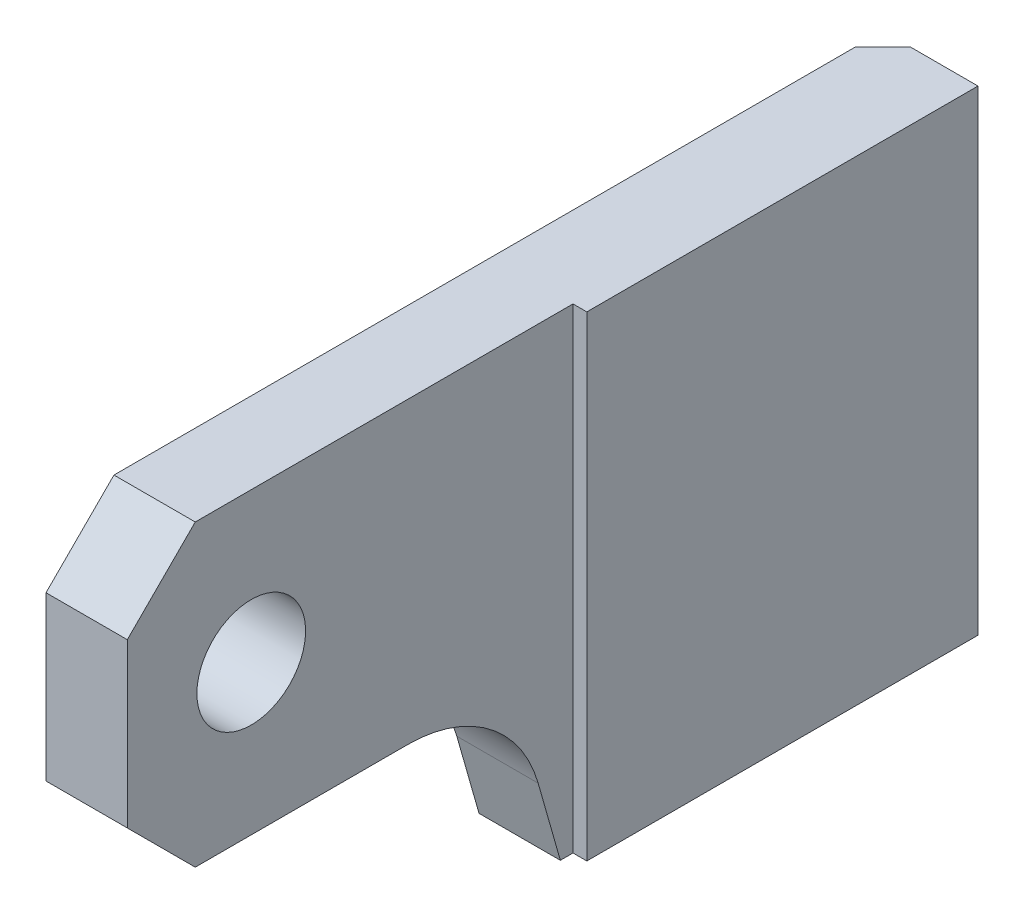
from build123d import *

# Parameters (mm, degrees)
EXTRUDE_1_DEPTH     = 7
FILLET_1_R          = 10
CHAMFER_1_SIZE      = 5
CHAMFER_2_SIZE      = 2
SKETCH_2_W          = 22.368466887
SKETCH_2_H          = 53.156625086
CUT_EXTRUDE_1_DEPTH = 100.184312104
SKETCH_3_R          = 4
CUT_EXTRUDE_2_DEPTH = 100.50128502


with BuildPart() as part:
    # Эскиз1 → Вытянуть1 (new body)
    with BuildSketch(Plane(origin=(0, 0, 0), x_dir=(0, 0, -1), z_dir=(1, 0, 0))):
        Polygon((62.822655934, -35.882923805), (59.120013374, -22.888409733), (30.956731402, -22.888409733), (30.956731402, -0.888409733), (92.539330922, -0.888409733), (92.539330922, -35.888409733), align=None)
    extrude(amount=-EXTRUDE_1_DEPTH)

    # Скругление1
    fillet_1_edges = [part.edges().sort_by_distance(p)[0] for p in [
        (-3.5, -22.888409733, -59.120013374),
    ]]
    fillet(fillet_1_edges, radius=FILLET_1_R)

    # Фаска1
    chamfer_1_edges = [part.edges().sort_by_distance(p)[0] for p in [
        (-3.5, -0.888409733, -30.956731402),
        (-3.5, -22.888409733, -30.956731402),
    ]]
    chamfer(chamfer_1_edges, length=CHAMFER_1_SIZE)

    # Фаска2
    chamfer_2_edges = [part.edges().sort_by_distance(p)[0] for p in [
        (-7, -18.388409733, -92.539330922),
    ]]
    chamfer(chamfer_2_edges, length=CHAMFER_2_SIZE)

    # Эскиз2 → Вырез-Вытянуть1 (cut, through all)
    with BuildSketch(Plane(origin=(0, -0.888409733, 0), x_dir=(-1, 0, 0), z_dir=(0, 1, 0))):
        with Locations((-10.167320296, -37.175286002)):
            Rectangle(SKETCH_2_W, SKETCH_2_H)
    extrude(amount=-CUT_EXTRUDE_1_DEPTH, mode=Mode.SUBTRACT)

    # Эскиз3 → Вырез-Вытянуть2 (cut, through all)
    with BuildSketch(Plane.ZY.offset(7)):
        with Locations((-40.076852625, -11.888409733)):
            Circle(SKETCH_3_R)
    extrude(amount=-CUT_EXTRUDE_2_DEPTH, mode=Mode.SUBTRACT)


solid = part.part
